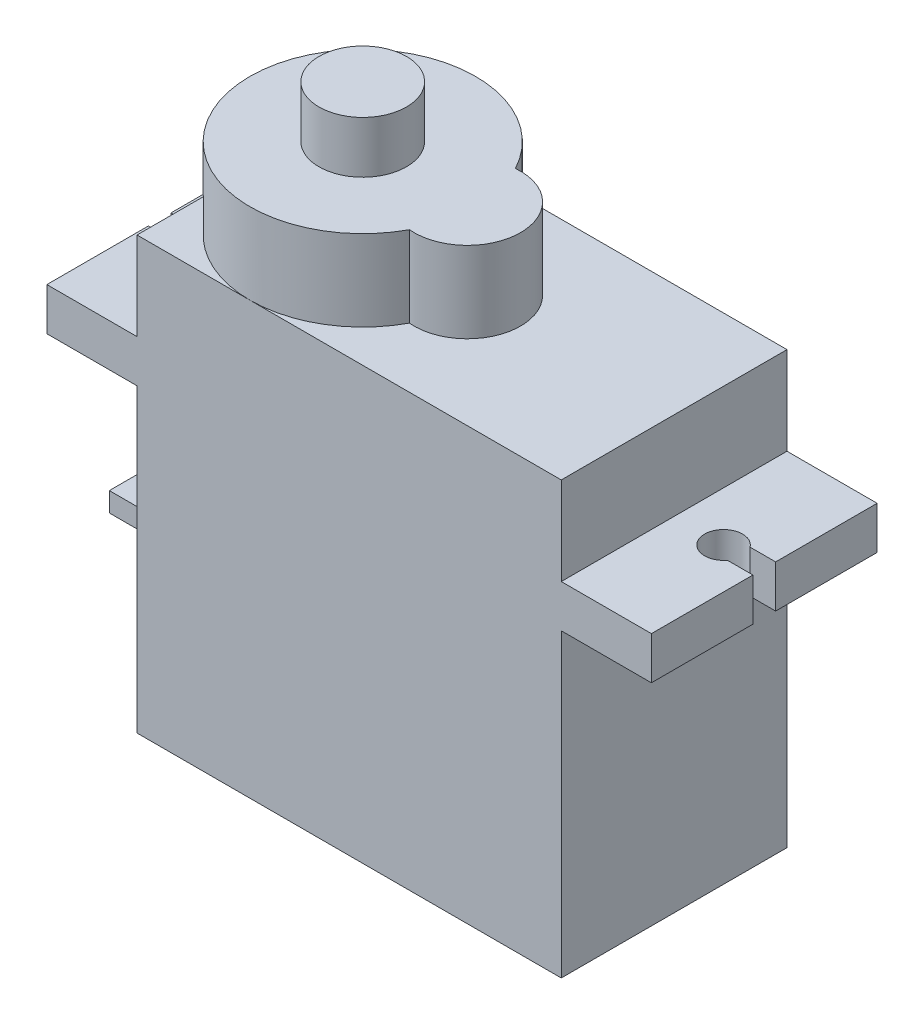
from build123d import *

# Parameters (mm, degrees)
SKETCH1_W           = 22.7711
SKETCH1_H           = 12.1158
BOSS_EXTRUDE1_DEPTH = 23.1521
SKETCH3_W           = 32.4485
SKETCH3_H           = 12.1158
BOSS_EXTRUDE2_DEPTH = 2.286
CUT_EXTRUDE1_DEPTH  = 36.336578682
BOSS_EXTRUDE3_DEPTH = 4.3434
SKETCH6_R           = 2.3495
BOSS_EXTRUDE4_DEPTH = 2.7813
SKETCH7_W           = 2.8956
SKETCH7_H           = 1.0414
BOSS_EXTRUDE5_DEPTH = 6.096


with BuildPart() as part:
    # Sketch1 → Boss-Extrude1 (new body)
    with BuildSketch(Plane(origin=(0, 0, 0), x_dir=(1, 0, 0), z_dir=(0, 1, 0))):
        with Locations((11.38555, 6.0579)):
            Rectangle(SKETCH1_W, SKETCH1_H)
    extrude(amount=BOSS_EXTRUDE1_DEPTH)

    # Sketch3 → Boss-Extrude2 (add)
    with BuildSketch(Plane(origin=(0, 18.4277, 0), x_dir=(1, 0, 0), z_dir=(0, 1, 0))):
        with Locations((11.38555, 6.0579)):
            Rectangle(SKETCH3_W, SKETCH3_H)
    extrude(amount=-BOSS_EXTRUDE2_DEPTH)

    # Sketch4 → Cut-Extrude1 (cut, through all)
    with BuildSketch(Plane(origin=(0, 18.4277, 0), x_dir=(1, 0, 0), z_dir=(0, 1, 0))):
        with BuildLine():
            Line((-4.8387, 6.6675), (-3.4671, 6.6675))
            ThreePointArc((-3.4671, 6.6675), (-1.6383, 6.0579), (-3.4671, 5.4483))
            Line((-3.4671, 5.4483), (-4.8387, 5.4483))
            Line((-4.8387, 5.4483), (-4.8387, 6.6675))
        make_face()
        with BuildLine():
            Line((26.2382, 5.4483), (27.6098, 5.4483))
            Line((27.6098, 5.4483), (27.6098, 6.6675))
            Line((27.6098, 6.6675), (26.2382, 6.6675))
            ThreePointArc((26.2382, 6.6675), (24.4094, 6.0579), (26.2382, 5.4483))
        make_face()
    extrude(amount=-CUT_EXTRUDE1_DEPTH, mode=Mode.SUBTRACT)

    # Sketch5 → Boss-Extrude3 (add)
    with BuildSketch(Plane(origin=(0, 23.1521, 0), x_dir=(1, 0, 0), z_dir=(0, 1, 0))):
        with BuildLine():
            ThreePointArc((11.406094118, 8.903066443), (0, 6.0579), (11.406094118, 3.212733557))
            ThreePointArc((11.406094118, 3.212733557), (14.5288, 6.0579), (11.406094118, 8.903066443))
        make_face()
    extrude(amount=BOSS_EXTRUDE3_DEPTH)

    # Sketch6 → Boss-Extrude4 (add)
    with BuildSketch(Plane(origin=(0, 27.4955, 0), x_dir=(1, 0, 0), z_dir=(0, 1, 0))):
        with Locations((6.0579, 6.0579)):
            Circle(SKETCH6_R)
    extrude(amount=BOSS_EXTRUDE4_DEPTH)

    # Sketch7 → Boss-Extrude5 (add)
    with BuildSketch(Plane.ZY):
        with Locations((-6.0579, 5.3975)):
            Rectangle(SKETCH7_W, SKETCH7_H)
    extrude(amount=BOSS_EXTRUDE5_DEPTH)


solid = part.part
